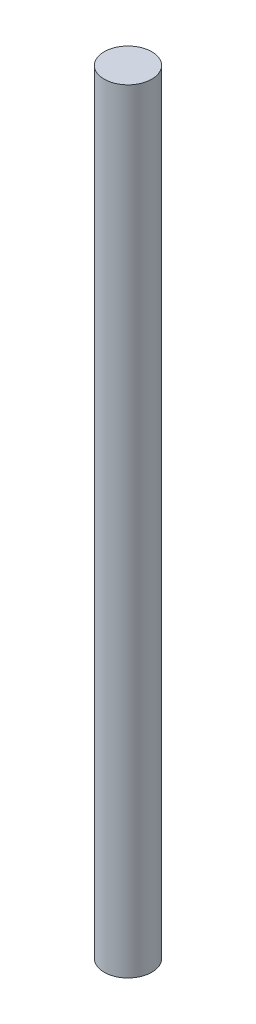
from build123d import *

# Parameters (mm, degrees)
SKETCH1_R           = 4
BOSS_EXTRUDE1_DEPTH = 130


with BuildPart() as part:
    # Sketch1 → Boss-Extrude1 (new body)
    with BuildSketch(Plane(origin=(0, 0, 0), x_dir=(1, 0, 0), z_dir=(0, 1, 0))):
        Circle(SKETCH1_R)
    extrude(amount=BOSS_EXTRUDE1_DEPTH)


solid = part.part
